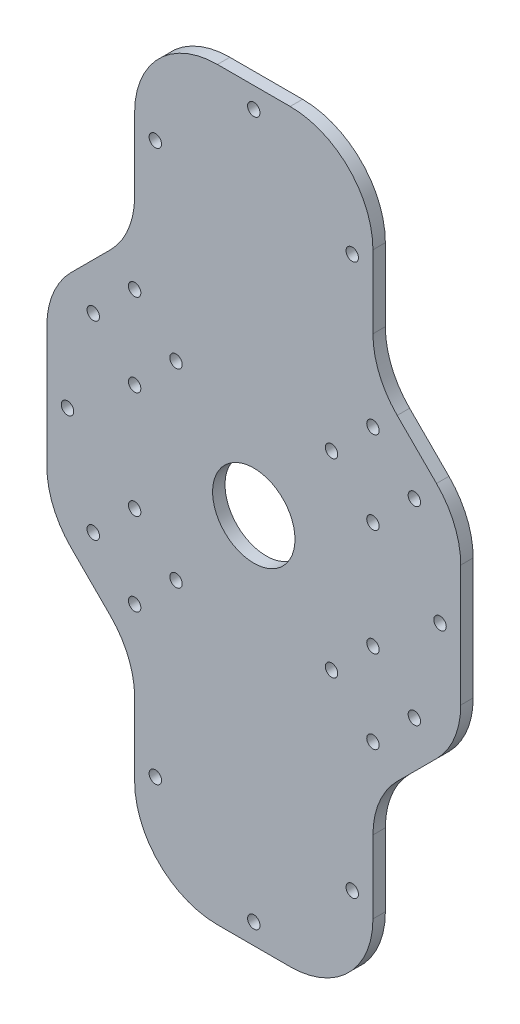
from build123d import *

# Parameters (mm, degrees)
BOSS_EXTRUDE1_OUTLINE_R                    = 9.950311947
BOSS_EXTRUDE1_DEPTH                        = 3
SKETCH2_R                                  = 1.5
CUT_EXTRUDE1_DEPTH                         = 104
MIRROR1_AT_THE_SECOND_PLANE_COPY_1_SKETC_R = 1.5
MIRROR1_AT_THE_SECOND_PLANE_COPY_1_DEPTH   = 104
SKETCH3_R                                  = 1.5
CUT_EXTRUDE2_DEPTH                         = 104
MIRROR2_AT_THE_SECOND_PLANE_COPY_1_SKETC_R = 1.5
MIRROR2_AT_THE_SECOND_PLANE_COPY_1_DEPTH   = 104
FILLET1_R                                  = 20


# Read off the part's stored shape, not the designer's step: Boss-Extrude1
with BuildPart() as part:
    # Boss-Extrude1 outline → Boss-Extrude1 (new body)
    with BuildSketch(Plane.XY):
        Polygon((28.786796564, 44.142135624), (28.786796564, 90), (-28.786796564, 90), (-28.786796564, 44.142135624), (-50, 22.928932188), (-50, -22.928932188), (-28.786796564, -44.142135624), (-28.786796564, -90), (28.786796564, -90), (28.786796564, -44.142135624), (50, -22.928932188), (50, 22.928932188), align=None)
        Circle(BOSS_EXTRUDE1_OUTLINE_R, mode=Mode.SUBTRACT)
    extrude(amount=BOSS_EXTRUDE1_DEPTH)

    # Sketch2 → Cut-Extrude1 (cut, through all)
    with BuildSketch(Plane.XY.offset(3)):
        with Locations((-28.786796564, 32.928932188)):
            Circle(SKETCH2_R)
        with Locations((-18.786796564, 22.928932188)):
            Circle(SKETCH2_R)
        with Locations((-28.786796564, 12.928932188)):
            Circle(SKETCH2_R)
        with Locations((-38.786796564, 22.928932188)):
            Circle(SKETCH2_R)
    cut_extrude1 = extrude(amount=-CUT_EXTRUDE1_DEPTH, mode=Mode.SUBTRACT)

    # Mirror1: Cut-Extrude1 across plane
    add(cut_extrude1.mirror(Plane(origin=(0, 0, 0), x_dir=(0, 0, 1), z_dir=(1, 0, 0))), mode=Mode.SUBTRACT)

    # Mirror1 at the second plane: Cut-Extrude1 across plane
    add(cut_extrude1.mirror(Plane.ZX), mode=Mode.SUBTRACT)

    # Mirror1 at the second plane copy 1 sketc → Mirror1 at the second plane copy 1 (cut, through all)
    with BuildSketch(Plane(origin=(0, 0, 3), x_dir=(-1, 0, 0), z_dir=(0, 0, 1))):
        with Locations((-28.786796564, 32.928932188)):
            Circle(MIRROR1_AT_THE_SECOND_PLANE_COPY_1_SKETC_R)
        with Locations((-18.786796564, 22.928932188)):
            Circle(MIRROR1_AT_THE_SECOND_PLANE_COPY_1_SKETC_R)
        with Locations((-28.786796564, 12.928932188)):
            Circle(MIRROR1_AT_THE_SECOND_PLANE_COPY_1_SKETC_R)
        with Locations((-38.786796564, 22.928932188)):
            Circle(MIRROR1_AT_THE_SECOND_PLANE_COPY_1_SKETC_R)
    extrude(amount=-MIRROR1_AT_THE_SECOND_PLANE_COPY_1_DEPTH, mode=Mode.SUBTRACT)

    # Sketch3 → Cut-Extrude2 (cut, through all)
    with BuildSketch(Plane.XY.offset(3)):
        with Locations((0, 85)):
            Circle(SKETCH3_R)
        with Locations((-23.786796564, 66.575)):
            Circle(SKETCH3_R)
        with Locations((-45, 0)):
            Circle(SKETCH3_R)
    cut_extrude2 = extrude(amount=-CUT_EXTRUDE2_DEPTH, mode=Mode.SUBTRACT)

    # Mirror2: Cut-Extrude2 across plane
    add(cut_extrude2.mirror(Plane(origin=(0, 0, 0), x_dir=(0, 0, 1), z_dir=(1, 0, 0))), mode=Mode.SUBTRACT)

    # Mirror2 at the second plane: Cut-Extrude2 across plane
    add(cut_extrude2.mirror(Plane.ZX), mode=Mode.SUBTRACT)

    # Mirror2 at the second plane copy 1 sketc → Mirror2 at the second plane copy 1 (cut, through all)
    with BuildSketch(Plane(origin=(0, 0, 3), x_dir=(-1, 0, 0), z_dir=(0, 0, 1))):
        with Locations((0, 85)):
            Circle(MIRROR2_AT_THE_SECOND_PLANE_COPY_1_SKETC_R)
        with Locations((-23.786796564, 66.575)):
            Circle(MIRROR2_AT_THE_SECOND_PLANE_COPY_1_SKETC_R)
        with Locations((-45, 0)):
            Circle(MIRROR2_AT_THE_SECOND_PLANE_COPY_1_SKETC_R)
    extrude(amount=-MIRROR2_AT_THE_SECOND_PLANE_COPY_1_DEPTH, mode=Mode.SUBTRACT)

    # Fillet1
    fillet1_edges = [part.edges().sort_by_distance(p)[0] for p in [
        (28.786796564, 44.142135624, 1.5),
        (50, 22.928932188, 1.5),
        (50, -22.928932188, 1.5),
        (28.786796564, -44.142135624, 1.5),
        (28.786796564, -90, 1.5),
        (-28.786796564, -90, 1.5),
        (-28.786796564, -44.142135624, 1.5),
        (-50, -22.928932188, 1.5),
        (-50, 22.928932188, 1.5),
        (-28.786796564, 44.142135624, 1.5),
        (-28.786796564, 90, 1.5),
        (28.786796564, 90, 1.5),
    ]]
    fillet(fillet1_edges, radius=FILLET1_R)


solid = part.part
